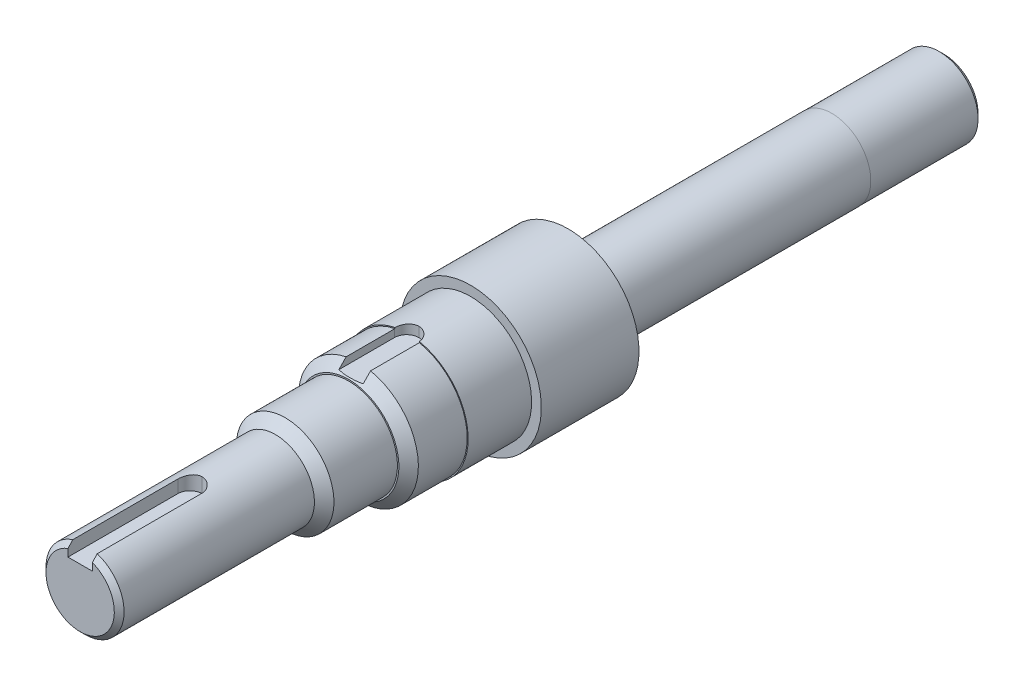
from build123d import *

# Parameters (mm, degrees)
SKETCH1_R          = 8
EXTRUDE1_DEPTH     = 40
SKETCH2_W          = 5
SKETCH2_H          = 3.872152866
CUT_EXTRUDE1_DEPTH = 25
FILLET1_R          = 2.5
CHAMFER1_SIZE      = 1
SKETCH3_R          = 10
EXTRUDE2_DEPTH     = 15
CHAMFER2_SIZE      = 2
SKETCH4_R          = 12.3
EXTRUDE3_DEPTH     = 12
CHAMFER3_SIZE      = 2
SKETCH5_R          = 12.5
EXTRUDE4_DEPTH     = 13
SKETCH6_R          = 14.5
EXTRUDE5_DEPTH     = 20
SKETCH10_W         = 5
SKETCH10_H         = 6.103543743
CUT_EXTRUDE2_DEPTH = 14.4
FILLET2_R          = 2.5
SKETCH9_R          = 8
EXTRUDE6_DEPTH     = 54
SKETCH11_W         = 4
SKETCH11_H         = 18
CUT_EXTRUDE3_DEPTH = 156.968746869
FILLET3_R          = 2
SKETCH12_R         = 7.975
EXTRUDE7_DEPTH     = 23
CHAMFER4_SIZE      = 1


# Some blends are built 0.0001 mm under size
with BuildPart() as part:
    # Sketch1 → Extrude1 (new body)
    with BuildSketch(Plane.XY):
        Circle(SKETCH1_R)
    extrude(amount=-EXTRUDE1_DEPTH)

    # Sketch2 → Cut-Extrude1 (cut)
    with BuildSketch(Plane.XY):
        with Locations((0, 6.936076433)):
            Rectangle(SKETCH2_W, SKETCH2_H)
    extrude(amount=-CUT_EXTRUDE1_DEPTH, mode=Mode.SUBTRACT)

    # Fillet1
    fillet1_edges = [part.edges().sort_by_distance(p)[0] for p in [
        (2.5, 6.299671038, -25),
        (-2.5, 6.299671038, -25),
    ]]
    fillet(fillet1_edges, radius=FILLET1_R - 0.0001)  # a hair under: the kernel refuses the full size

    # Chamfer1
    chamfer1_edges = [part.edges().sort_by_distance(p)[0] for p in [
        (-4.69041576, -6.480740698, 0),
    ]]
    chamfer(chamfer1_edges, length=CHAMFER1_SIZE)

    # Sketch3 → Extrude2 (add)
    with BuildSketch(Plane(origin=(0, 0, -40), x_dir=(-1, 0, 0), z_dir=(0, 0, -1))):
        Circle(SKETCH3_R)
    extrude(amount=EXTRUDE2_DEPTH)

    # Chamfer2
    chamfer2_edges = [part.edges().sort_by_distance(p)[0] for p in [
        (10, 0, -40),
    ]]
    chamfer(chamfer2_edges, length=CHAMFER2_SIZE - 0.0001)  # a hair under: the kernel refuses the full size

    # Sketch4 → Extrude3 (add)
    with BuildSketch(Plane(origin=(0, 0, -55), x_dir=(-1, 0, 0), z_dir=(0, 0, -1))):
        Circle(SKETCH4_R)
    extrude(amount=EXTRUDE3_DEPTH)

    # Chamfer3
    chamfer3_edges = [part.edges().sort_by_distance(p)[0] for p in [
        (12.3, 0, -55),
    ]]
    chamfer(chamfer3_edges, length=CHAMFER3_SIZE)

    # Sketch5 → Extrude4 (add)
    with BuildSketch(Plane(origin=(0, 0, -67), x_dir=(-1, 0, 0), z_dir=(0, 0, -1))):
        with Locations(Location((0, 0, 0), (0, 0, 180))):
            Circle(SKETCH5_R)
    extrude(amount=EXTRUDE4_DEPTH)

    # Sketch6 → Extrude5 (add)
    with BuildSketch(Plane(origin=(0, 0, -80), x_dir=(-1, 0, 0), z_dir=(0, 0, -1))):
        Circle(SKETCH6_R)
    extrude(amount=EXTRUDE5_DEPTH)

    # Sketch10 → Cut-Extrude2 (cut)
    with BuildSketch(Plane.XY.offset(-55)):
        with Locations((0, 13.551771871)):
            Rectangle(SKETCH10_W, SKETCH10_H)
    extrude(amount=-CUT_EXTRUDE2_DEPTH, mode=Mode.SUBTRACT)

    # Fillet2
    # the kernel refuses this fillet: 2.5 mm, written as the material it adds along each edge
    with BuildSketch(Plane(origin=(2.5, 18.497448714, -69.4), x_dir=(0, 0, 1), z_dir=(0, -1, 0))) as fillet2_piece_1_section:
        with BuildLine():
            CenterArc((FILLET2_R, FILLET2_R), FILLET2_R, 180, 90)
            Line((0, FILLET2_R), (0, 0))
            Line((0, 0), (FILLET2_R, 0))
        make_face()
    fillet2_piece_1 = extrude(amount=14.247448714, mode=Mode.PRIVATE)
    fillet2_piece_1 = fillet2_piece_1 & Plane(origin=(0, 0, -68.840122938), x_dir=(1, 0, 0), z_dir=(0, 0, 1)) * Cylinder(12.5, 39, mode=Mode.PRIVATE)
    fillet2_piece_1 = split(fillet2_piece_1, bisect_by=Plane(origin=(1.944027658, 12.237538555, -67), z_dir=(0, 0, -1)), keep=Keep.TOP, mode=Mode.PRIVATE)
    add(fillet2_piece_1)
    with BuildSketch(Plane(origin=(2.5, 18.497448714, -69.4), x_dir=(0, 0, 1), z_dir=(0, -1, 0))) as fillet2_piece_2_section:
        with BuildLine():
            CenterArc((FILLET2_R, FILLET2_R), FILLET2_R, 180, 90)
            Line((0, FILLET2_R), (0, 0))
            Line((0, 0), (FILLET2_R, 0))
        make_face()
    fillet2_piece_2 = extrude(amount=14.247448714, mode=Mode.PRIVATE)
    fillet2_piece_2 = fillet2_piece_2 & Plane(origin=(0, 0, -66.975002686), x_dir=(-1, 0, 0), z_dir=(0, 0, 1)) * Cylinder(12.3, 39, mode=Mode.PRIVATE)
    add(fillet2_piece_2)
    with BuildSketch(Plane(origin=(-2.5, 4.25, -69.4), x_dir=(1, 0, 0), z_dir=(0, 1, 0))) as fillet2_piece_3_section:
        with BuildLine():
            CenterArc((FILLET2_R, -FILLET2_R), FILLET2_R, 90, 90)
            Line((0, -FILLET2_R), (0, 0))
            Line((0, 0), (FILLET2_R, 0))
        make_face()
    fillet2_piece_3 = extrude(amount=14.247448714, mode=Mode.PRIVATE)
    fillet2_piece_3 = fillet2_piece_3 & Plane(origin=(0, 0, -68.853362748), x_dir=(1, 0, 0), z_dir=(0, 0, 1)) * Cylinder(12.5, 39, mode=Mode.PRIVATE)
    fillet2_piece_3 = split(fillet2_piece_3, bisect_by=Plane(origin=(-1.922744222, 11.319637846, -67), z_dir=(0, 0, -1)), keep=Keep.TOP, mode=Mode.PRIVATE)
    add(fillet2_piece_3)
    with BuildSketch(Plane(origin=(-2.5, 4.25, -69.4), x_dir=(1, 0, 0), z_dir=(0, 1, 0))) as fillet2_piece_4_section:
        with BuildLine():
            CenterArc((FILLET2_R, -FILLET2_R), FILLET2_R, 90, 90)
            Line((0, -FILLET2_R), (0, 0))
            Line((0, 0), (FILLET2_R, 0))
        make_face()
    fillet2_piece_4 = extrude(amount=14.247448714, mode=Mode.PRIVATE)
    fillet2_piece_4 = fillet2_piece_4 & Plane(origin=(0, 0, -66.975002689), x_dir=(-1, 0, 0), z_dir=(0, 0, 1)) * Cylinder(12.3, 39, mode=Mode.PRIVATE)
    add(fillet2_piece_4)

    # Sketch9 → Extrude6 (add)
    with BuildSketch(Plane(origin=(0, 0, -100), x_dir=(-1, 0, 0), z_dir=(0, 0, -1))):
        with Locations(Location((0, 0, 0), (0, 0, 108.209956864))):
            Circle(SKETCH9_R)
    extrude(amount=EXTRUDE6_DEPTH)

    # Sketch11 → Cut-Extrude3 (cut, through all)
    with BuildSketch(Plane(origin=(0, -5.5, 0), x_dir=(-1, 0, 0), z_dir=(0, 1, 0))):
        with Locations((0, -110)):
            Rectangle(SKETCH11_W, SKETCH11_H)
    extrude(amount=-CUT_EXTRUDE3_DEPTH, mode=Mode.SUBTRACT)

    # Fillet3
    fillet3_edges = [part.edges().sort_by_distance(p)[0] for p in [
        (-2, -6.622983346, -119),
        (2, -6.622983346, -119),
        (-2, -6.622983346, -101),
        (2, -6.622983346, -101),
    ]]
    fillet(fillet3_edges, radius=FILLET3_R - 0.0001)  # a hair under: the kernel refuses the full size

    # Sketch12 → Extrude7 (add)
    with BuildSketch(Plane(origin=(0, 0, -154), x_dir=(-1, 0, 0), z_dir=(0, 0, -1))):
        Circle(SKETCH12_R)
    extrude(amount=EXTRUDE7_DEPTH)

    # Chamfer4
    chamfer4_edges = [part.edges().sort_by_distance(p)[0] for p in [
        (7.975, 0, -177),
    ]]
    chamfer(chamfer4_edges, length=CHAMFER4_SIZE)


solid = part.part
